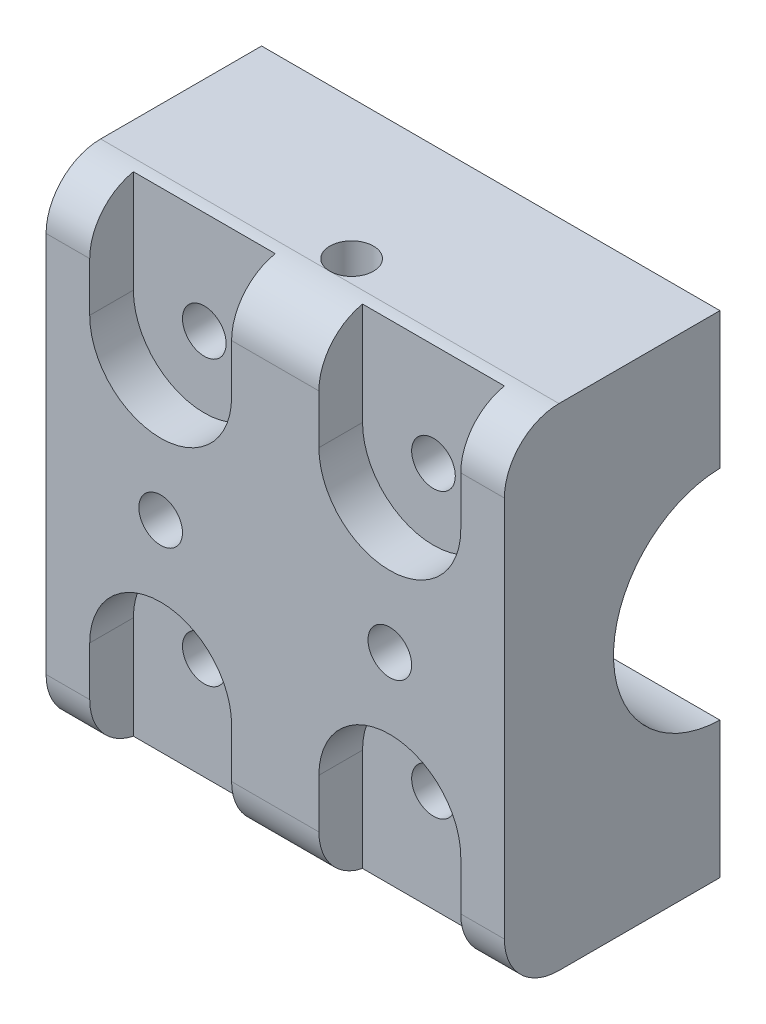
from build123d import *

# Parameters (mm, degrees)
BOSS_EXTRUDE1_DEPTH = 42
SKETCH2_R           = 2
CUT_EXTRUDE2_DEPTH  = 52.578217301
CUT_EXTRUDE3_DEPTH  = 4
SKETCH4_R           = 2
CUT_EXTRUDE4_DEPTH  = 52.578217301
SKETCH5_R           = 2
CUT_EXTRUDE5_DEPTH  = 65.722484597


with BuildPart() as part:
    # Sketch1 → Boss-Extrude1 (new body)
    with BuildSketch(Plane(origin=(0, 0, 0), x_dir=(0, 0, -1), z_dir=(1, 0, 0))):
        with BuildLine():
            Line((-0.25, 9.996874512), (-0.25, 22.5))
            Line((-0.25, 22.5), (-15, 22.5))
            ThreePointArc((-15, 22.5), (-18.535533906, 21.035533906), (-20, 17.5))
            Line((-20, 17.5), (-20, -17.5))
            ThreePointArc((-20, -17.5), (-18.535533906, -21.035533906), (-15, -22.5))
            Line((-15, -22.5), (-0.25, -22.5))
            Line((-0.25, -22.5), (-0.25, -9.996874512))
            ThreePointArc((-0.25, -9.996874512), (-10, 0), (-0.25, 9.996874512))
        make_face()
    extrude(amount=-BOSS_EXTRUDE1_DEPTH)

    # Sketch2 → Cut-Extrude2 (cut, through all)
    with BuildSketch(Plane.XY.offset(0.25)):
        with Locations((-31.5, 13)):
            Circle(SKETCH2_R)
        with Locations((-10.5, 13)):
            Circle(SKETCH2_R)
        with Locations((-10.5, -13)):
            Circle(SKETCH2_R)
        with Locations((-31.5, -13)):
            Circle(SKETCH2_R)
    extrude(amount=CUT_EXTRUDE2_DEPTH, mode=Mode.SUBTRACT)

    # Sketch3 → Cut-Extrude3 (cut)
    with BuildSketch(Plane.XY.offset(20)):
        with BuildLine():
            Line((-38, 13), (-38, 22.5))
            Line((-38, 22.5), (-25, 22.5))
            Line((-25, 22.5), (-25, 13))
            ThreePointArc((-25, 13), (-31.5, 6.5), (-38, 13))
        make_face()
        with BuildLine():
            Line((-17, 13), (-17, 22.5))
            Line((-17, 22.5), (-4, 22.5))
            Line((-4, 22.5), (-4, 13))
            ThreePointArc((-4, 13), (-10.5, 6.5), (-17, 13))
        make_face()
        with BuildLine():
            Line((-4, -22.5), (-4, -13))
            ThreePointArc((-4, -13), (-10.5, -6.5), (-17, -13))
            Line((-17, -13), (-17, -22.5))
            Line((-17, -22.5), (-4, -22.5))
        make_face()
        with BuildLine():
            Line((-25, -22.5), (-25, -13))
            ThreePointArc((-25, -13), (-31.5, -6.5), (-38, -13))
            Line((-38, -13), (-38, -22.5))
            Line((-38, -22.5), (-25, -22.5))
        make_face()
    extrude(amount=-CUT_EXTRUDE3_DEPTH, mode=Mode.SUBTRACT)

    # Sketch4 → Cut-Extrude4 (cut, through all)
    with BuildSketch(Plane.XY.offset(20)):
        with Locations((-10.5, 0)):
            Circle(SKETCH4_R)
        with Locations((-31.5, 0)):
            Circle(SKETCH4_R)
    extrude(amount=-CUT_EXTRUDE4_DEPTH, mode=Mode.SUBTRACT)

    # Sketch5 → Cut-Extrude5 (cut, through all)
    with BuildSketch(Plane.XZ.offset(22.5)):
        with Locations((-21, 13)):
            Circle(SKETCH5_R)
    extrude(amount=-CUT_EXTRUDE5_DEPTH, mode=Mode.SUBTRACT)


solid = part.part
